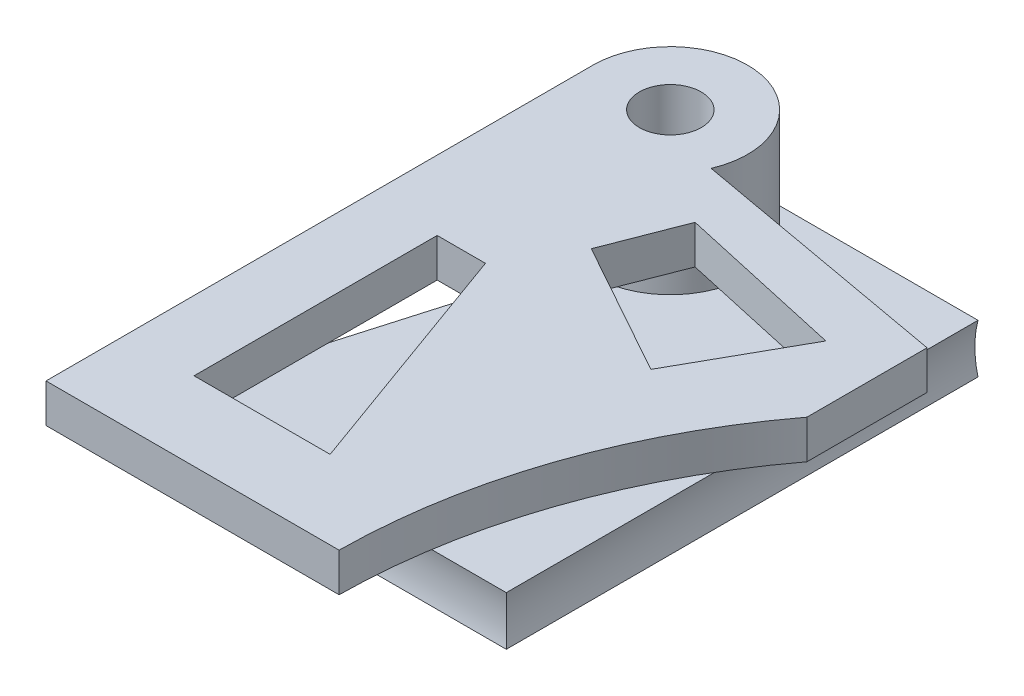
from build123d import *

# Parameters (mm, degrees)
BOSS_EXTRUDE1_DEPTH     = 6.35
SKETCH1_3_R             = 4
BOSS_EXTRUDE2_DEPTH     = 20
CUT_EXTRUDE1_DEPTH      = 54.690022776
CUT_EXTRUDE1_DEPTH_BACK = 54.690022776
SKETCH3_R               = 12.5
CUT_EXTRUDE3_DEPTH      = 54.690022776
CUT_EXTRUDE3_DEPTH_BACK = 54.690022776
SKETCH4_R               = 12.5
BOSS_EXTRUDE3_START     = -5
BOSS_EXTRUDE3_DEPTH     = 5


with BuildPart() as part:
    # Sketch1 → Boss-Extrude1 (new body)
    with BuildSketch(Plane(origin=(0, 0, 0), x_dir=(1, 0, 0), z_dir=(0, 1, 0))):
        with BuildLine():
            Line((30.820134884, -21.881687341), (30.820134884, 39.118312659))
            Line((30.820134884, 39.118312659), (1.797901548, 39.118312659))
            ThreePointArc((1.797901548, 39.118312659), (8.347755505, 35.933299364), (11.000000332, 29.150195803))
            ThreePointArc((11.000000332, 29.150195803), (7.147460265, 21.262944294), (-1.441746942, 19.452883276))
            Line((-1.441746942, 19.452883276), (-13.427648664, -21.881687341))
            Line((-13.427648664, -21.881687341), (30.820134884, -21.881687341))
        make_face()
    extrude(amount=BOSS_EXTRUDE1_DEPTH)

    # Sketch1<3> → Boss-Extrude2 (add)
    with BuildSketch(Plane(origin=(0, 0, 0), x_dir=(1, 0, 0), z_dir=(0, 1, 0))):
        with BuildLine():
            ThreePointArc((11.000000332, 29.150195803), (8.347755505, 35.933299364), (1.797901548, 39.118312659))
            ThreePointArc((1.797901548, 39.118312659), (-8.8670071, 30.775669374), (-1.441746942, 19.452883276))
            ThreePointArc((-1.441746942, 19.452883276), (7.147460265, 21.262944294), (11.000000332, 29.150195803))
        make_face()
        with Locations((1.000000332, 29.150195803)):
            Circle(SKETCH1_3_R, mode=Mode.SUBTRACT)
    extrude(amount=BOSS_EXTRUDE2_DEPTH)

    # Sketch3 → Cut-Extrude1 (cut, two sides: drawn at the far end of the back side and taken through both)
    with BuildSketch(Plane.XY.offset(-CUT_EXTRUDE1_DEPTH_BACK)):
        with Locations((42.910187614, 3.175)):
            Circle(SKETCH3_R)
    extrude(amount=CUT_EXTRUDE1_DEPTH + CUT_EXTRUDE1_DEPTH_BACK, mode=Mode.SUBTRACT)

    # Sketch4 → Cut-Extrude3 (cut, two sides: drawn at the far end of the back side and taken through both)
    with BuildSketch(Plane(origin=(0, 0, 0), x_dir=(0, 0, -1), z_dir=(1, 0, 0)).offset(-CUT_EXTRUDE3_DEPTH_BACK)):
        with Locations((-33.971740071, 3.175)):
            Circle(SKETCH4_R)
    extrude(amount=CUT_EXTRUDE3_DEPTH + CUT_EXTRUDE3_DEPTH_BACK, mode=Mode.SUBTRACT)

    # Sketch5 → Boss-Extrude3 (add)
    with BuildSketch(Plane(origin=(0, 20, 0), x_dir=(1, 0, 0), z_dir=(0, 1, 0)).offset(BOSS_EXTRUDE3_START)):
        with BuildLine():
            ThreePointArc((10.199132733, 25.228976213), (-1.001083873, 19.352458207), (-8.999999668, 29.150195803))
            Line((-8.999999668, 29.150195803), (-8.999999668, -41.582926526))
            Line((-8.999999668, -41.582926526), (28.900435068, -41.582926526))
            ThreePointArc((28.900435068, -41.582926526), (32.954506387, -17.779400719), (44.256083353, 3.558773833))
            Line((44.256083353, 3.558773833), (44.256083353, 19.094758402))
            Line((44.256083353, 19.094758402), (10.199132733, 25.228976213))
        make_face()
        Polygon((17.594978634, -31.436293162), (0, -31.436293162), (0, 0), (6.242345966, 0), align=None, mode=Mode.SUBTRACT)
        Polygon((28.816009284, -1.183711765), (11.455147871, 8.481691767), (15.20184924, 18.147095298), (36.949007186, 13.314393532), align=None, mode=Mode.SUBTRACT)
    extrude(amount=BOSS_EXTRUDE3_DEPTH)


solid = part.part
